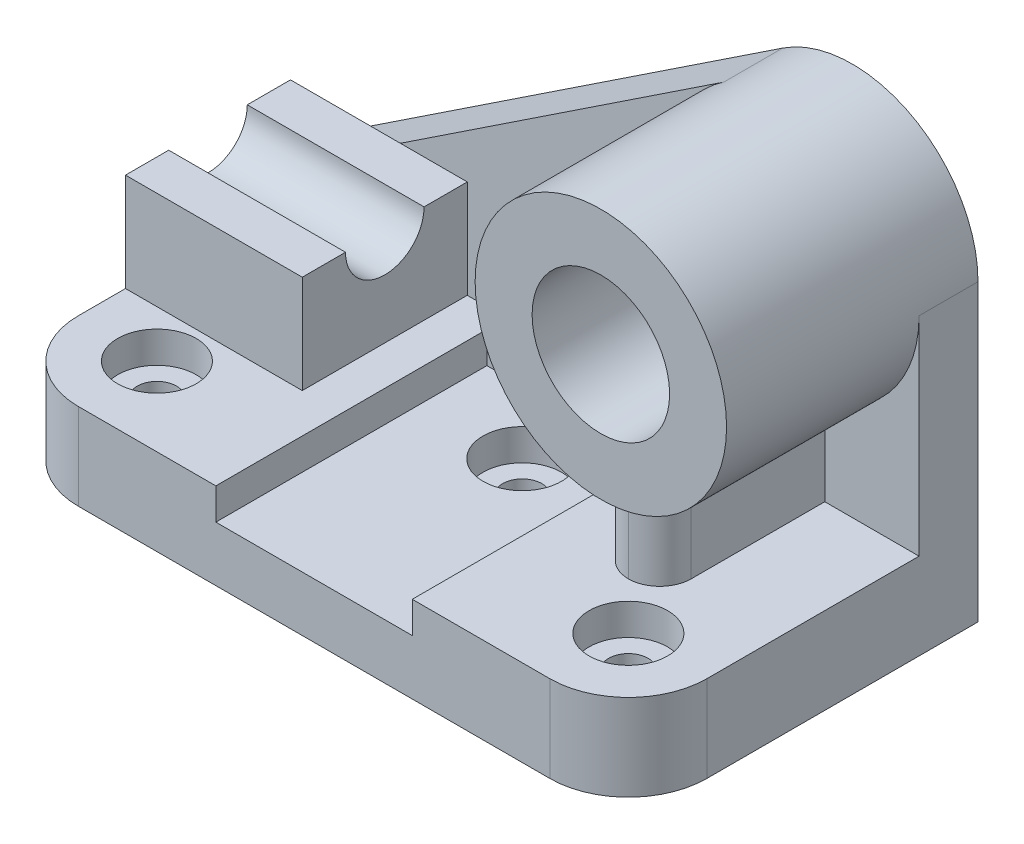
from build123d import *

# Parameters (mm, degrees)
CROQUIS3_W              = 160
CROQUIS3_H              = 22
SALIENTE_EXTRUIR1_DEPTH = 89
CROQUIS6_W              = 50
CROQUIS6_H              = 8
CORTAR_EXTRUIR1_DEPTH   = 69
REDONDEO1_R             = 20
REDONDEO2_R             = 20
CROQUIS7_R              = 17.5
SALIENTE_EXTRUIR3_DEPTH = 15
CROQUIS8_R              = 32
CROQUIS8_R_2            = 17.5
SALIENTE_EXTRUIR4_DEPTH = 49
CROQUIS9_W              = 45
CROQUIS9_H              = 25
CROQUIS9_W_2            = 16
SALIENTE_EXTRUIR5_DEPTH = 42
REDONDEO3_R             = 8
REDONDEO4_R             = 8
CROQUIS10_W             = 45
CROQUIS10_H             = 10


with BuildPart() as part:
    # Croquis3 → Saliente-Extruir1 (new body)
    with BuildSketch(Plane.XY):
        with Locations((80, 11)):
            Rectangle(CROQUIS3_W, CROQUIS3_H)
    extrude(amount=-SALIENTE_EXTRUIR1_DEPTH)

    # Croquis6 → Cortar-Extruir1 (cut)
    with BuildSketch(Plane.XY):
        with Locations((80, 18)):
            Rectangle(CROQUIS6_W, CROQUIS6_H)
    extrude(amount=-CORTAR_EXTRUIR1_DEPTH, mode=Mode.SUBTRACT)

    # Redondeo1
    redondeo1_edges = [part.edges().sort_by_distance(p)[0] for p in [
        (160, 11, 0),
    ]]
    fillet(redondeo1_edges, radius=REDONDEO1_R)

    # Redondeo2
    redondeo2_edges = [part.edges().sort_by_distance(p)[0] for p in [
        (0, 11, 0),
    ]]
    fillet(redondeo2_edges, radius=REDONDEO2_R)



with BuildPart() as body_2:
    # Croquis7 → Saliente-Extruir3 (new body)
    with BuildSketch(Plane(origin=(0, 0, -89), x_dir=(-1, 0, 0), z_dir=(0, 0, -1))):
        with BuildLine():
            Line((0, 22), (-160, 22))
            Line((-160, 22), (-160, 75))
            ThreePointArc((-160, 75), (-143.127064471, 103.198792891), (-110.301754969, 101.660309879))
            Line((-110.301754969, 101.660309879), (-5.363158113, 31.997616205))
            ThreePointArc((-5.363158113, 31.997616205), (-1.425452666, 27.672649177), (0, 22))
        make_face()
        with Locations((-128, 75)):
            Circle(CROQUIS7_R, mode=Mode.SUBTRACT)
    extrude(amount=-SALIENTE_EXTRUIR3_DEPTH)

    # Croquis8 → Saliente-Extruir4 (add)
    with BuildSketch(Plane.XY.offset(-74)):
        with Locations((128, 75)):
            Circle(CROQUIS8_R)
        with Locations(Location((128, 75, 0), (0, 0, 180))):
            Circle(CROQUIS8_R_2, mode=Mode.SUBTRACT)
    extrude(amount=SALIENTE_EXTRUIR4_DEPTH)


with BuildPart() as part_1:
    add(part.part)

    add(body_2.part)  # Saliente-Extruir5 merges body 2
    # Croquis9 → Saliente-Extruir5 (add)
    with BuildSketch(Plane.XY.offset(-74)):
        with Locations((22.5, 34.5)):
            Rectangle(CROQUIS9_W, CROQUIS9_H)
        with Locations((128, 34.5)):
            Rectangle(CROQUIS9_W_2, CROQUIS9_H)
    extrude(amount=SALIENTE_EXTRUIR5_DEPTH)

    # Redondeo3
    redondeo3_edges = [part_1.edges().sort_by_distance(p)[0] for p in [
        (136, 33.008066615, -32),
    ]]
    fillet(redondeo3_edges, radius=REDONDEO3_R)

    # Redondeo4
    redondeo4_edges = [part_1.edges().sort_by_distance(p)[0] for p in [
        (120, 33.008066615, -32),
    ]]
    fillet(redondeo4_edges, radius=REDONDEO4_R - 0.0001)  # a hair under: the kernel refuses the full size

    # Croquis10 → Cortar-Revolución1 (revolve, cut)
    with BuildSketch(Plane.XY.offset(-53)):
        with Locations((22.5, 42)):
            Rectangle(CROQUIS10_W, CROQUIS10_H)
    revolve(axis=Axis((45, 47, -53), (-1, 0, 0)), mode=Mode.SUBTRACT)

    # Croquis14 → Cortar-Revolución2 (revolve, cut)
    with BuildSketch(Plane.XY.offset(-53), mode=Mode.PRIVATE) as cortar_revoluci_n2_sk:
        Polygon((70, 14), (70, 6), (75, 6), (75, -24.123756484), (80, -24.123756484), (80, 14), align=None)
    revolve(cortar_revoluci_n2_sk.sketch.rotate(Axis((80, 14, -53), (0, -1, 0)), 270), axis=Axis((80, 14, -53), (0, -1, 0)), mode=Mode.SUBTRACT)

    # Croquis16 → Cortar-Revolución3 (revolve, cut)
    with BuildSketch(Plane.XY.offset(-20)):
        Polygon((10, 22), (10, 14), (15, 14), (15, -14.561047929), (20, -14.561047929), (20, 22), align=None)
    revolve(axis=Axis((20, 59.332394472, -20), (0, -1, 0)), mode=Mode.SUBTRACT)

    # Croquis17 → Cortar-Revolución4 (revolve, cut)
    with BuildSketch(Plane.XY.offset(-20), mode=Mode.PRIVATE) as cortar_revoluci_n4_sk:
        Polygon((140, 22), (150, 22), (150, 14), (145, 14), (145, 0), (140, 0), align=None)
    revolve(cortar_revoluci_n4_sk.sketch.rotate(Axis((140, -22.856797355, -20), (0, 1, 0)), 90), axis=Axis((140, -22.856797355, -20), (0, 1, 0)), mode=Mode.SUBTRACT)


solid = part_1.part
